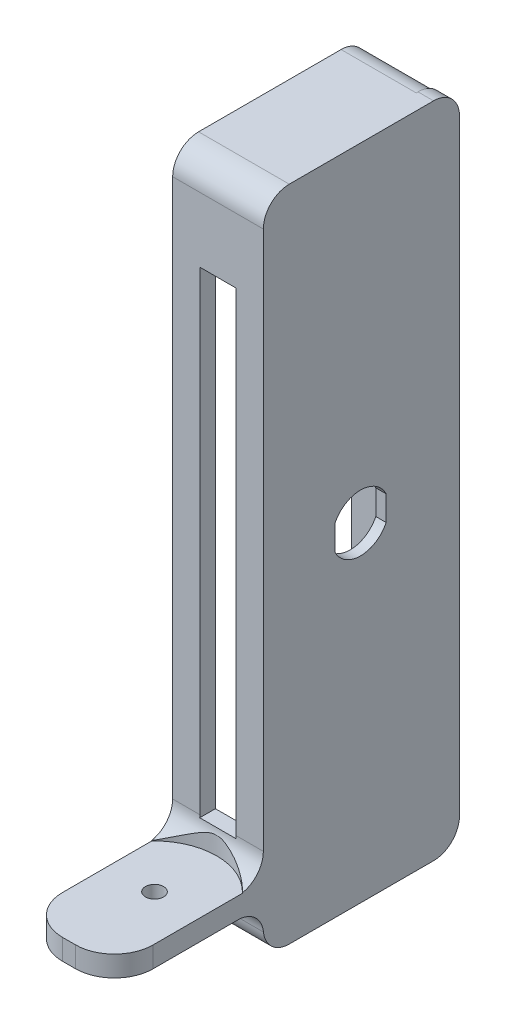
from build123d import *

# Parameters (mm, degrees)
SKETCH3_W                 = 75
SKETCH3_H                 = 254
BOSS_EXTRUDE2_DEPTH       = 35
SHELL2_T                  = -6
CUT_EXTRUDE1_DEPTH        = 2
CUT_EXTRUDE2_DEPTH        = 137.000919115
SKETCH6_W                 = 14
SKETCH6_H                 = 184
CUT_EXTRUDE3_DEPTH        = 152.58825812
FILLET1_R                 = 10
FILLET2_R                 = 5
SKETCH12_W                = 57.5
SKETCH12_H                = 8
BOSS_EXTRUDE4_DEPTH       = 35
FILLET5_R                 = 10
FILLET6_R                 = 15
M8X1_0_TAPPED_HOLE1_D     = 7
M8X1_0_TAPPED_HOLE1_DEPTH = 8
M8X1_0_TAPPED_HOLE1_TIP   = 2.103012167
SKETCH16_R                = 24
CUT_EXTRUDE4_DEPTH        = 91
BOSS_EXTRUDE5_DEPTH       = 6
CUT_EXTRUDE5_DEPTH        = 29


with BuildPart() as part:
    # Sketch3 → Boss-Extrude2 (new body)
    with BuildSketch(Plane(origin=(0, 0, 0), x_dir=(0, 0, -1), z_dir=(1, 0, 0))):
        Rectangle(SKETCH3_W, SKETCH3_H)
    extrude(amount=BOSS_EXTRUDE2_DEPTH)

    # Shell2
    shell2_openings = [part.faces().sort_by_distance(p)[0] for p in [
        (35, 0, 0),
    ]]
    offset(amount=SHELL2_T, openings=shell2_openings, kind=Kind.INTERSECTION)

    # Sketch4 → Cut-Extrude1 (cut)
    with BuildSketch(Plane(origin=(6, 0, 0), x_dir=(0, 0, -1), z_dir=(1, 0, 0))):
        with BuildLine():
            Line((12.9, -5.439669108), (12.9, 5.439669108))
            ThreePointArc((12.9, 5.439669108), (0.363761531, 13.9952734), (-12.6, 6.102458521))
            Line((-12.6, 6.102458521), (-12.6, -6.102458521))
            ThreePointArc((-12.6, -6.102458521), (0.363761531, -13.9952734), (12.9, -5.439669108))
        make_face()
    cut_extrude1 = extrude(amount=-CUT_EXTRUDE1_DEPTH, mode=Mode.SUBTRACT)

    # Sketch5 → Cut-Extrude2 (cut, through all)
    with BuildSketch(Plane(origin=(4, 0, 0), x_dir=(0, 0, -1), z_dir=(1, 0, 0))):
        with BuildLine():
            Line((9.9, -4.794788838), (9.9, 4.794788838))
            ThreePointArc((9.9, 4.794788838), (0, 11), (-9.9, 4.794788838))
            Line((-9.9, 4.794788838), (-9.9, -4.794788838))
            ThreePointArc((-9.9, -4.794788838), (0, -11), (9.9, -4.794788838))
        make_face()
    cut_extrude2 = extrude(amount=-CUT_EXTRUDE2_DEPTH, mode=Mode.SUBTRACT)

    # Sketch6 → Cut-Extrude3 (cut, through all)
    with BuildSketch(Plane.XY.offset(37.5)):
        with Locations((17.5, 0)):
            Rectangle(SKETCH6_W, SKETCH6_H)
    extrude(amount=-CUT_EXTRUDE3_DEPTH, mode=Mode.SUBTRACT)

    # Fillet1
    fillet1_edges = [part.edges().sort_by_distance(p)[0] for p in [
        (17.5, -127, -37.5),
        (17.5, -127, 37.5),
        (17.5, 127, 37.5),
        (17.5, 127, -37.5),
    ]]
    fillet(fillet1_edges, radius=FILLET1_R)

    # Fillet2
    fillet2_edges = [part.edges().sort_by_distance(p)[0] for p in [
        (20.5, -121, -31.5),
        (20.5, 121, -31.5),
        (20.5, 121, 31.5),
        (20.5, -121, 31.5),
    ]]
    fillet(fillet2_edges, radius=FILLET2_R)

    # Sketch12 → Boss-Extrude4 (add)
    with BuildSketch(Plane(origin=(35, 0, 0), x_dir=(0, 0, -1), z_dir=(1, 0, 0))):
        with Locations((-66.25, -105)):
            Rectangle(SKETCH12_W, SKETCH12_H)
    extrude(amount=-BOSS_EXTRUDE4_DEPTH)

    # Fillet5
    # the kernel refuses this fillet: 10 mm, written as the material it adds along each edge
    with BuildSketch(Plane(origin=(35, -109, 37.5), x_dir=(0, -0.9999844906159053, -0.0055694279462415305), z_dir=(-1, 0, 0))) as fillet5_piece_1:
        with BuildLine():
            CenterArc((9.944708969, 9.955289483), FILLET5_R, 180.319106365, 84.260829523)
            Line((-0.055135937, 9.899595203), (-1.055120428, 9.894025775))
            Line((-1.055120428, 9.894025775), (-0.999984491, -0.005569428))
            Line((-0.999984491, -0.005569428), (0.005569428, -0.999984491))
            ThreePointArc((0.005569428, -0.999984491), (8.005445353, -0.955429067), (8.905682648, -0.995528948))
            Line((8.905682648, -0.995528948), (9.000139587, 0))
        make_face()
    extrude(amount=35)
    with BuildSketch(Plane(origin=(35, -101, 37.5), x_dir=(0, 1, 0), z_dir=(-1, 0, 0))) as fillet5_piece_2_section:
        with BuildLine():
            CenterArc((FILLET5_R, -FILLET5_R), FILLET5_R, 90, 90)
            Line((0, -FILLET5_R), (0, 0))
            Line((0, 0), (FILLET5_R, 0))
        make_face()
    fillet5_piece_2 = extrude(amount=35, mode=Mode.PRIVATE)
    fillet5_piece_2 = split(fillet5_piece_2, bisect_by=Plane(origin=(29.75, -92, 37.408860849), z_dir=(0, 1, 0)), keep=Keep.TOP, mode=Mode.PRIVATE)
    fillet5_piece_2 = split(fillet5_piece_2, bisect_by=Plane(origin=(24.5, -91.519267155, 37.408860849), z_dir=(1, 0, 0)), keep=Keep.TOP, mode=Mode.PRIVATE)
    add(fillet5_piece_2)
    with BuildSketch(Plane(origin=(35, -101, 37.5), x_dir=(0, 1, 0), z_dir=(-1, 0, 0))) as fillet5_piece_3_section:
        with BuildLine():
            CenterArc((FILLET5_R, -FILLET5_R), FILLET5_R, 90, 90)
            Line((0, -FILLET5_R), (0, 0))
            Line((0, 0), (FILLET5_R, 0))
        make_face()
    fillet5_piece_3 = extrude(amount=35, mode=Mode.PRIVATE)
    fillet5_piece_3 = split(fillet5_piece_3, bisect_by=Plane(origin=(29.75, -92, 39.784135406), z_dir=(0, -1, 0)), keep=Keep.TOP, mode=Mode.PRIVATE)
    fillet5_piece_3 = split(fillet5_piece_3, bisect_by=Plane(origin=(24.5, -98.797900168, 39.784135406), z_dir=(1, 0, 0)), keep=Keep.TOP, mode=Mode.PRIVATE)
    add(fillet5_piece_3)
    with BuildSketch(Plane(origin=(35, -101, 37.5), x_dir=(0, 1, 0), z_dir=(-1, 0, 0))) as fillet5_piece_4_section:
        with BuildLine():
            CenterArc((FILLET5_R, -FILLET5_R), FILLET5_R, 90, 90)
            Line((0, -FILLET5_R), (0, 0))
            Line((0, 0), (FILLET5_R, 0))
        make_face()
    fillet5_piece_4 = extrude(amount=35, mode=Mode.PRIVATE)
    fillet5_piece_4 = split(fillet5_piece_4, bisect_by=Plane(origin=(10.5, -98.797900168, 39.784135406), z_dir=(1, 0, 0)), keep=Keep.TOP, mode=Mode.PRIVATE)
    fillet5_piece_4 = split(fillet5_piece_4, bisect_by=Plane(origin=(17.5, -92, 39.784135406), z_dir=(0, -1, 0)), keep=Keep.TOP, mode=Mode.PRIVATE)
    fillet5_piece_4 = split(fillet5_piece_4, bisect_by=Plane(origin=(24.5, -98.797900168, 39.784135406), z_dir=(-1, 0, 0)), keep=Keep.TOP, mode=Mode.PRIVATE)
    add(fillet5_piece_4)
    with BuildSketch(Plane(origin=(35, -101, 37.5), x_dir=(0, 1, 0), z_dir=(-1, 0, 0))) as fillet5_piece_5_section:
        with BuildLine():
            CenterArc((FILLET5_R, -FILLET5_R), FILLET5_R, 90, 90)
            Line((0, -FILLET5_R), (0, 0))
            Line((0, 0), (FILLET5_R, 0))
        make_face()
    fillet5_piece_5 = extrude(amount=35, mode=Mode.PRIVATE)
    fillet5_piece_5 = split(fillet5_piece_5, bisect_by=Plane(origin=(10.5, -91.519267155, 37.408860849), z_dir=(-1, 0, 0)), keep=Keep.TOP, mode=Mode.PRIVATE)
    fillet5_piece_5 = split(fillet5_piece_5, bisect_by=Plane(origin=(5.25, -92, 37.408860849), z_dir=(0, 1, 0)), keep=Keep.TOP, mode=Mode.PRIVATE)
    add(fillet5_piece_5)
    with BuildSketch(Plane(origin=(35, -101, 37.5), x_dir=(0, 1, 0), z_dir=(-1, 0, 0))) as fillet5_piece_6_section:
        with BuildLine():
            CenterArc((FILLET5_R, -FILLET5_R), FILLET5_R, 90, 90)
            Line((0, -FILLET5_R), (0, 0))
            Line((0, 0), (FILLET5_R, 0))
        make_face()
    fillet5_piece_6 = extrude(amount=35, mode=Mode.PRIVATE)
    fillet5_piece_6 = split(fillet5_piece_6, bisect_by=Plane(origin=(10.5, -98.797900168, 39.784135406), z_dir=(-1, 0, 0)), keep=Keep.TOP, mode=Mode.PRIVATE)
    fillet5_piece_6 = split(fillet5_piece_6, bisect_by=Plane(origin=(5.25, -92, 39.784135406), z_dir=(0, -1, 0)), keep=Keep.TOP, mode=Mode.PRIVATE)
    add(fillet5_piece_6)

    # Fillet6
    fillet6_edges = [part.edges().sort_by_distance(p)[0] for p in [
        (35, -105, 95),
        (0, -105, 95),
    ]]
    fillet(fillet6_edges, radius=FILLET6_R)

    # M8x1.0 Tapped Hole1
    with Locations(Plane(origin=(17.5, -101, 62), x_dir=(0, 0, 1), z_dir=(0, 1, 0))):
        with Locations((0, 0)):
            Hole(M8X1_0_TAPPED_HOLE1_D / 2, depth=M8X1_0_TAPPED_HOLE1_DEPTH)
            with Locations((0, 0, -(M8X1_0_TAPPED_HOLE1_DEPTH + M8X1_0_TAPPED_HOLE1_TIP / 2))):  # 118° drill point
                Cone(0, M8X1_0_TAPPED_HOLE1_D / 2, M8X1_0_TAPPED_HOLE1_TIP, mode=Mode.SUBTRACT)

    # Sketch16 → Cut-Extrude4 (cut)
    with BuildSketch(Plane(origin=(0, -101, 0), x_dir=(1, 0, 0), z_dir=(0, 1, 0))):
        with Locations((17.5, -62)):
            Circle(SKETCH16_R)
    extrude(amount=CUT_EXTRUDE4_DEPTH, mode=Mode.SUBTRACT)

    # Sketch17 → Boss-Extrude5 (add)
    with BuildSketch(Plane(origin=(35, 0, 0), x_dir=(0, 0, -1), z_dir=(1, 0, 0))):
        with BuildLine():
            Line((-26.806920407, -127), (28.193079593, -127))
            ThreePointArc((28.193079593, -127), (35.264147405, -124.071067812), (38.193079593, -117))
            Line((38.193079593, -117), (38.193079593, 117))
            ThreePointArc((38.193079593, 117), (35.264147405, 124.071067812), (28.193079593, 127))
            Line((28.193079593, 127), (-26.806920527, 127))
            ThreePointArc((-26.806920527, 127), (-33.878742431, 124.070313639), (-36.806920299, 116.997866992))
            Line((-36.806920299, 116.997866992), (-36.756795058, -117.999997222))
            ThreePointArc((-36.756795058, -117.999997222), (-33.515125375, -124.416197551), (-26.806920407, -127))
        make_face()
    extrude(amount=-BOSS_EXTRUDE5_DEPTH)

    # Mirror1: Cut-Extrude1, Cut-Extrude2 across plane
    add(cut_extrude1.mirror(Plane.ZY.offset(-17.5)), mode=Mode.SUBTRACT)
    add(cut_extrude2.mirror(Plane.ZY.offset(-17.5)), mode=Mode.SUBTRACT)

    # Sketch18 → Cut-Extrude5 (cut)
    with BuildSketch(Plane.ZY):
        with BuildLine():
            ThreePointArc((31.5, 117), (30.328427125, 119.828427125), (27.5, 121))
            Line((27.5, 121), (-27.5, 121))
            ThreePointArc((-27.5, 121), (-30.328427125, 119.828427125), (-31.5, 117))
            Line((-31.5, 117), (-31.5, -117))
            ThreePointArc((-31.5, -117), (-30.328427125, -119.828427125), (-27.5, -121))
            Line((-27.5, -121), (27.5, -121))
            ThreePointArc((27.5, -121), (30.328427125, -119.828427125), (31.5, -117))
            Line((31.5, -117), (31.5, 117))
        make_face()
        with BuildLine():
            Line((-9.9, -4.794788838), (-9.9, 4.794788838))
            ThreePointArc((-9.9, 4.794788838), (0, 11), (9.9, 4.794788838))
            Line((9.9, 4.794788838), (9.9, -4.794788838))
            ThreePointArc((9.9, -4.794788838), (0, -11), (-9.9, -4.794788838))
        make_face(mode=Mode.SUBTRACT)
    extrude(amount=-CUT_EXTRUDE5_DEPTH, mode=Mode.SUBTRACT)


solid = part.part
